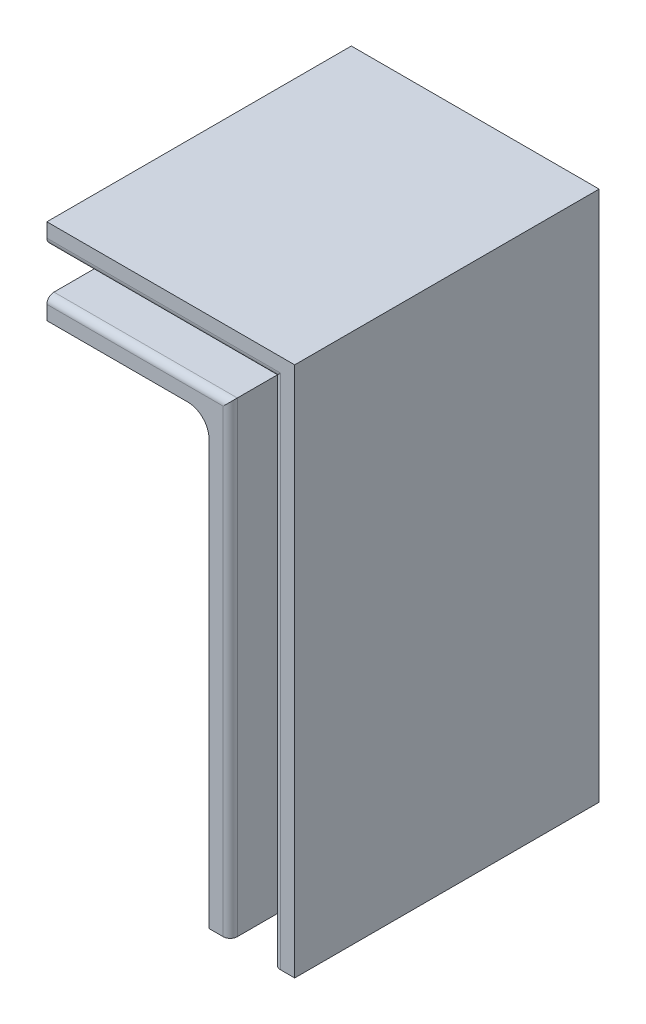
from build123d import *

# Parameters (mm, degrees)
SKETCH1_W           = 35
SKETCH1_H           = 75
BOSS_EXTRUDE1_DEPTH = 3
BOSS_EXTRUDE2_DEPTH = 40
FILLET1_R           = 3
FILLET2_R           = 1


with BuildPart() as part:
    # Sketch1 → Boss-Extrude1 (new body)
    with BuildSketch(Plane.XY):
        with Locations((17.5, 37.5)):
            Rectangle(SKETCH1_W, SKETCH1_H)
    extrude(amount=BOSS_EXTRUDE1_DEPTH)

    # Sketch2 → Boss-Extrude2 (add)
    with BuildSketch(Plane.XY.offset(3)):
        Polygon((0, 75), (35, 75), (35, 0), (32, 0), (32, 72), (0, 72), align=None)
        Polygon((0, 65.9), (25.9, 65.9), (25.9, 0), (22.9, 0), (22.9, 62.9), (0, 62.9), align=None)
    extrude(amount=BOSS_EXTRUDE2_DEPTH)

    # Fillet1
    fillet1_edges = [part.edges().sort_by_distance(p)[0] for p in [
        (25.9, 32.95, 3),
        (12.95, 65.9, 3),
        (16, 72, 3),
        (22.9, 62.9, 23),
        (11.45, 62.9, 3),
        (22.9, 31.45, 3),
        (32, 36, 3),
    ]]
    fillet(fillet1_edges, radius=FILLET1_R)

    # Fillet2
    fillet2_edges = [part.edges().sort_by_distance(p)[0] for p in [
        (12.95, 65.9, 43),
        (16, 72, 43),
        (32, 36, 43),
        (25.9, 32.95, 43),
    ]]
    fillet(fillet2_edges, radius=FILLET2_R)


solid = part.part
